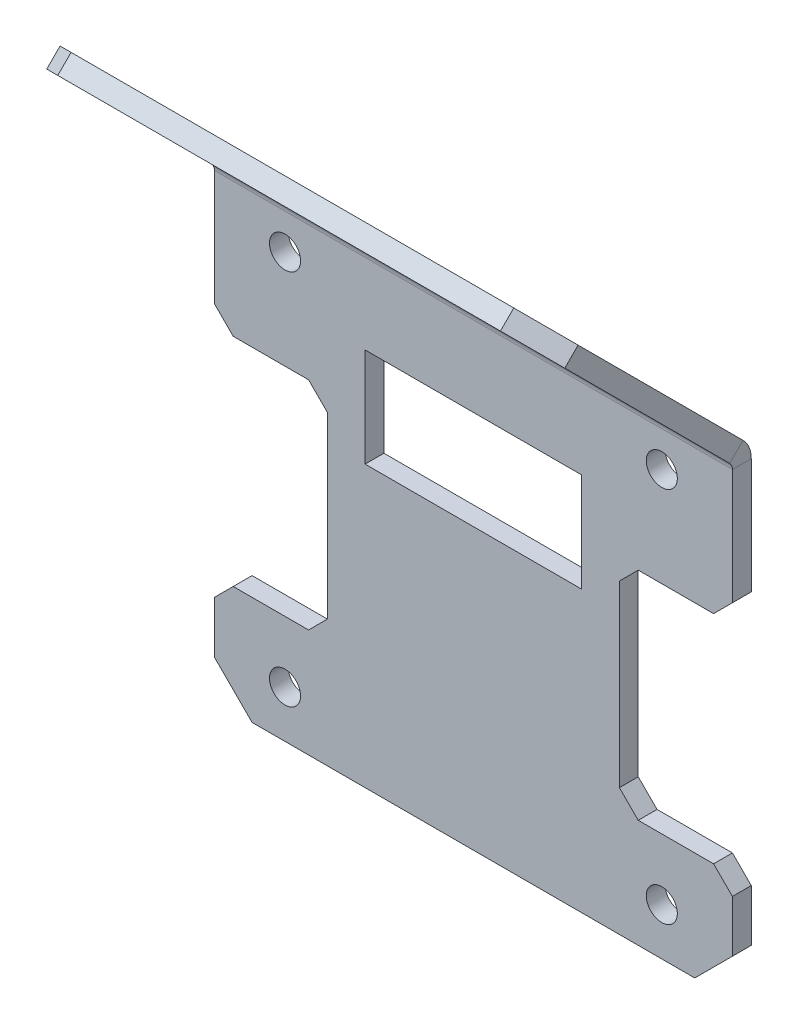
from build123d import *

# Parameters (mm, degrees)
SM_BASE_FLANGE_1_DEPTH = 27.5
CHAMFER_1_SIZE         = 4
SKETCH_6_R             = 9.5
CUT_EXTRUDE_1_DEPTH    = 62.386073339
SKETCH_7_W             = 12
SKETCH_7_H             = 23
CUT_EXTRUDE_2_DEPTH    = 62.386073339
CHAMFER_2_SIZE         = 2
SKETCH_9_W             = 23
SKETCH_9_H             = 10.5
CUT_EXTRUDE_4_DEPTH    = 62.386073339
CUT_EXTRUDE_5_REACH    = 63.386
SKETCH_10_R            = 1.65


# Sheet-metal steps are written as plain solids
with BuildPart() as part:
    # Sketch 1 → 基材-凸緣1 (new, symmetric)
    with BuildSketch(Plane(origin=(0, 0, 0), x_dir=(0, 1, 0), z_dir=(-1, 0, 0))):
        with BuildLine():
            Line((-50, 0), (-1.242640687, 0))
            ThreePointArc((-1.242640687, 0), (-0.09459039, -0.228361402), (0.878679656, -0.878679656))
            Line((0.878679656, -0.878679656), (21.213203436, -21.213203436))
            Line((21.213203436, -21.213203436), (19.798989873, -22.627416998))
            Line((19.798989873, -22.627416998), (-0.535533906, -2.292893219))
            ThreePointArc((-0.535533906, -2.292893219), (-0.859957255, -2.076120467), (-1.242640687, -2))
            Line((-1.242640687, -2), (-50, -2))
            Line((-50, -2), (-50, 0))
        make_face()
    extrude(amount=SM_BASE_FLANGE_1_DEPTH, both=True)

    # 導角1
    chamfer_1_edges = [part.edges().sort_by_distance(p)[0] for p in [
        (-27.5, -50, 1),
        (-27.5, 20.506096654, 21.920310217),
        (27.5, -50, 1),
        (27.5, 20.506096654, 21.920310217),
    ]]
    chamfer(chamfer_1_edges, length=CHAMFER_1_SIZE)

    # 草圖6 → 除料-伸長1 (cut, through all)
    with BuildSketch(Plane(origin=(0, 0, 0), x_dir=(-0.9655064458746985, -0.1841158643007276, -0.18411586430072824), z_dir=(0, 0.7071067811865488, -0.7071067811865465))):
        with Locations(Location((-4.42644559, 16.41360958, 0), (0, 0, 105.092560886))):
            Circle(SKETCH_6_R)
    extrude(amount=-CUT_EXTRUDE_1_DEPTH, mode=Mode.SUBTRACT)

    # 草圖7 → 除料-伸長2 (cut, through all)
    with BuildSketch(Plane(origin=(0, 0, 0), x_dir=(-1, 0, 0), z_dir=(0, 0, -1))):
        with Locations((-21.5, -27)):
            Rectangle(SKETCH_7_W, SKETCH_7_H)
    cut_extrude_2 = extrude(amount=-CUT_EXTRUDE_2_DEPTH, mode=Mode.SUBTRACT)

    # 鏡射1: 除料-伸長2 across plane
    add(cut_extrude_2.mirror(Plane(origin=(0, 0, 0), x_dir=(0, 0, 1), z_dir=(1, 0, 0))), mode=Mode.SUBTRACT)

    # 導角2
    chamfer_2_edges = [part.edges().sort_by_distance(p)[0] for p in [
        (-15.5, -38.5, 1),
        (-15.5, -15.5, 1),
        (27.5, -38.5, 1),
        (27.5, -15.5, 1),
        (15.5, -15.5, 1),
        (15.5, -38.5, 1),
        (-27.5, -15.5, 1),
        (-27.5, -38.5, 1),
    ]]
    chamfer(chamfer_2_edges, length=CHAMFER_2_SIZE)

    # 草圖9 → 除料-伸長4 (cut, through all)
    with BuildSketch(Plane(origin=(0, 0, 0), x_dir=(-1, 0, 0), z_dir=(0, 0, -1))):
        with Locations((0, -15)):
            Rectangle(SKETCH_9_W, SKETCH_9_H)
    extrude(amount=-CUT_EXTRUDE_4_DEPTH, mode=Mode.SUBTRACT)

    # 草圖10 → 除料-伸長5 (cut, up to next)
    with BuildSketch(Plane(origin=(0, 0, 0), x_dir=(-1, 0, 0), z_dir=(0, 0, -1)), mode=Mode.PRIVATE) as cut_extrude_5_sk1:
        with Locations((20, -45)):
            Circle(SKETCH_10_R)
    cut_extrude_5_tool1 = extrude(cut_extrude_5_sk1.sketch, amount=-CUT_EXTRUDE_5_REACH, mode=Mode.PRIVATE) & part.part
    # 草圖10 → 除料-伸長5 (cut, up to next)
    with BuildSketch(Plane(origin=(0, 0, 0), x_dir=(-1, 0, 0), z_dir=(0, 0, -1)), mode=Mode.PRIVATE) as cut_extrude_5_sk2:
        with Locations((-20, -45)):
            Circle(SKETCH_10_R)
    cut_extrude_5_tool2 = extrude(cut_extrude_5_sk2.sketch, amount=-CUT_EXTRUDE_5_REACH, mode=Mode.PRIVATE) & part.part
    # 草圖10 → 除料-伸長5 (cut, up to next)
    with BuildSketch(Plane(origin=(0, 0, 0), x_dir=(-1, 0, 0), z_dir=(0, 0, -1)), mode=Mode.PRIVATE) as cut_extrude_5_sk3:
        with Locations((-20, -5)):
            Circle(SKETCH_10_R)
    cut_extrude_5_tool3 = extrude(cut_extrude_5_sk3.sketch, amount=-CUT_EXTRUDE_5_REACH, mode=Mode.PRIVATE) & part.part
    # 草圖10 → 除料-伸長5 (cut, up to next)
    with BuildSketch(Plane(origin=(0, 0, 0), x_dir=(-1, 0, 0), z_dir=(0, 0, -1)), mode=Mode.PRIVATE) as cut_extrude_5_sk4:
        with Locations((20, -5)):
            Circle(SKETCH_10_R)
    cut_extrude_5_tool4 = extrude(cut_extrude_5_sk4.sketch, amount=-CUT_EXTRUDE_5_REACH, mode=Mode.PRIVATE) & part.part
    add(cut_extrude_5_tool1.solids().sort_by_distance((-20, -45, 0))[0], mode=Mode.SUBTRACT)
    add(cut_extrude_5_tool2.solids().sort_by_distance((20, -45, 0))[0], mode=Mode.SUBTRACT)
    add(cut_extrude_5_tool3.solids().sort_by_distance((20, -5, 0))[0], mode=Mode.SUBTRACT)
    add(cut_extrude_5_tool4.solids().sort_by_distance((-20, -5, 0))[0], mode=Mode.SUBTRACT)


solid = part.part
